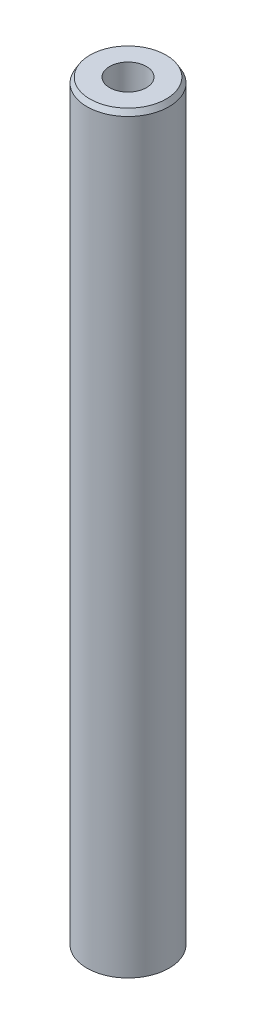
from build123d import *
from OCP.BRepFilletAPI import BRepFilletAPI_MakeChamfer

# Parameters (mm, degrees)
SKETCH1_R           = 22.5
BOSS_EXTRUDE1_DEPTH = 413.255893709
SKETCH2_R           = 10.091704943
CUT_EXTRUDE1_DEPTH  = 415.479111277
CHAMFER1_SIZE       = 2.818543055
CHAMFER1_SIZE2      = 1.627286592


with BuildPart() as part:
    # Sketch1 → Boss-Extrude1 (new body)
    with BuildSketch(Plane(origin=(0, 0, 0), x_dir=(1, 0, 0), z_dir=(0, 1, 0))):
        Circle(SKETCH1_R)
    extrude(amount=BOSS_EXTRUDE1_DEPTH)

    # Sketch2 → Cut-Extrude1 (cut, through all)
    with BuildSketch(Plane(origin=(0, 0, 0), x_dir=(1, 0, 0), z_dir=(0, 1, 0))):
        Circle(SKETCH2_R)
    extrude(amount=CUT_EXTRUDE1_DEPTH, mode=Mode.SUBTRACT)

    # Chamfer1: one chamfer whose edges measure the first distance from different faces: ONE call of the kernel's chamfer builder (chamfer() names one face for all edges)
    chamfer1_edges_1 = [part.edges().sort_by_distance(p)[0] for p in [
        (-22.5, 413.255893709, 0),
    ]]
    chamfer1_side_1 = [part.faces().sort_by_distance(p)[0] for p in [
        (-22.5, 206.627946855, 0),
    ]]
    chamfer1_edges_2 = [part.edges().sort_by_distance(p)[0] for p in [
        (-22.5, 0, 0),
    ]]
    chamfer1_side_2 = [part.faces().sort_by_distance(p)[0] for p in [
        (-21.863603897, 0, 0),
    ]]
    chamfer1 = BRepFilletAPI_MakeChamfer(part.part.solid().wrapped)
    for e in chamfer1_edges_1:
        chamfer1.Add(CHAMFER1_SIZE, CHAMFER1_SIZE2, e.wrapped, chamfer1_side_1[0].wrapped)  # the first distance lies on this face
    for e in chamfer1_edges_2:
        chamfer1.Add(CHAMFER1_SIZE, CHAMFER1_SIZE2, e.wrapped, chamfer1_side_2[0].wrapped)  # the first distance lies on this face
    add(Compound.cast(chamfer1.Shape()), mode=Mode.REPLACE)


solid = part.part
